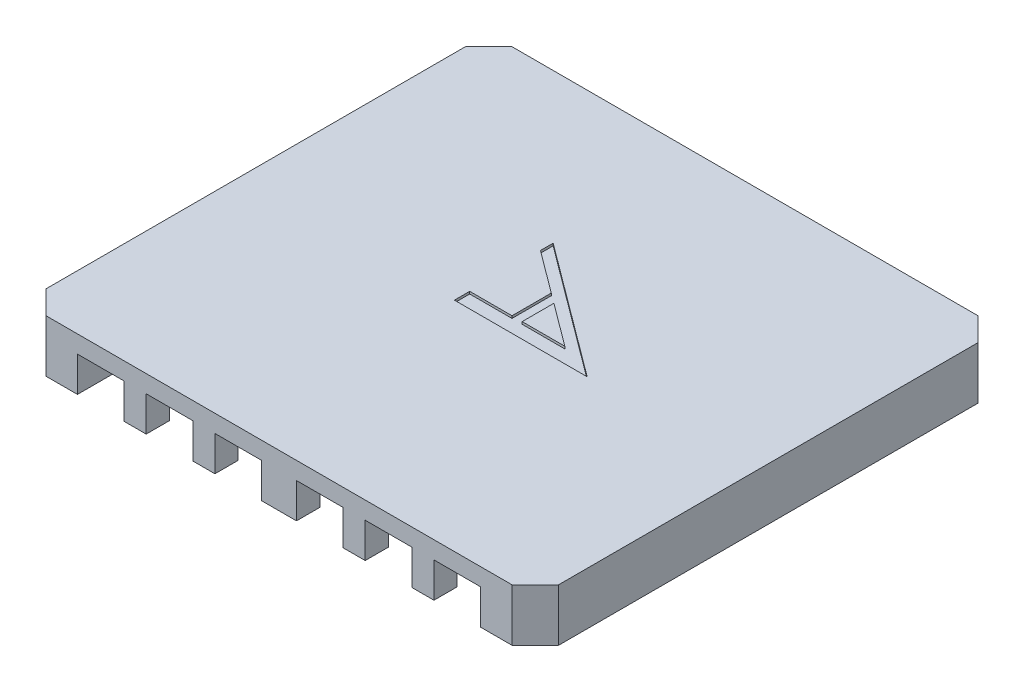
from build123d import *

# Parameters (mm, degrees)
SKETCH_1_W          = 44
SKETCH_1_H          = 40
EXTRUDE_1_DEPTH     = 4.5
CHAMFER_1_SIZE      = 2
SKETCH_2_W          = 34.6
SKETCH_2_H          = 36
SKETCH_2_W_2        = 3
SKETCH_2_H_2        = 20
CUT_EXTRUDE_1_DEPTH = 3
SKETCH_3_W          = 4
SKETCH_3_H          = 2
SKETCH_3_W_2        = 2.2
SKETCH_3_W_3        = 2.5
CUT_EXTRUDE_2_DEPTH = 3
SKETCH_4_R          = 1
CUT_EXTRUDE_3_DEPTH = 3.5
CUT_EXTRUDE1_DEPTH  = 0.2


with BuildPart() as part:
    # 草图1 → 凸台-拉伸1 (new body)
    with BuildSketch(Plane(origin=(0, 0, 0), x_dir=(1, 0, 0), z_dir=(0, 1, 0))):
        Rectangle(SKETCH_1_W, SKETCH_1_H)
    extrude(amount=EXTRUDE_1_DEPTH)

    # 倒角1
    chamfer_1_edges = [part.edges().sort_by_distance(p)[0] for p in [
        (-22, 2.25, -20),
        (22, 2.25, -20),
        (22, 2.25, 20),
        (-22, 2.25, 20),
    ]]
    chamfer(chamfer_1_edges, length=CHAMFER_1_SIZE)

    # 草图2 → 切除-拉伸1 (cut)
    with BuildSketch(Plane.XZ):
        Rectangle(SKETCH_2_W, SKETCH_2_H)
        Rectangle(SKETCH_2_W_2, SKETCH_2_H_2, mode=Mode.SUBTRACT)
    extrude(amount=-CUT_EXTRUDE_1_DEPTH, mode=Mode.SUBTRACT)

    # 草图3 → 切除-拉伸2 (cut)
    with BuildSketch(Plane.XZ):
        with Locations((-15.3, 19)):
            Rectangle(SKETCH_3_W, SKETCH_3_H)
        with Locations((-3.5, 19)):
            Rectangle(SKETCH_3_W, SKETCH_3_H)
        with Locations((-9.4, 19)):
            Rectangle(SKETCH_3_W, SKETCH_3_H)
        with Locations((3.5, 19)):
            Rectangle(SKETCH_3_W, SKETCH_3_H)
        with Locations((9.4, 19)):
            Rectangle(SKETCH_3_W, SKETCH_3_H)
        with Locations((15.3, 19)):
            Rectangle(SKETCH_3_W, SKETCH_3_H)
        with Locations((-2.6, -19)):
            Rectangle(SKETCH_3_W_2, SKETCH_3_H)
        with Locations((-9.4, -19)):
            Rectangle(SKETCH_3_W_3, SKETCH_3_H)
        with Locations((-16.2, -19)):
            Rectangle(SKETCH_3_W_2, SKETCH_3_H)
        with Locations((16.2, -19)):
            Rectangle(SKETCH_3_W_2, SKETCH_3_H)
        with Locations((9.4, -19)):
            Rectangle(SKETCH_3_W_3, SKETCH_3_H)
        with Locations((2.6, -19)):
            Rectangle(SKETCH_3_W_2, SKETCH_3_H)
    extrude(amount=-CUT_EXTRUDE_2_DEPTH, mode=Mode.SUBTRACT)

    # 草图4 → 切除-拉伸3 (cut)
    with BuildSketch(Plane.XZ):
        with Locations((19.3, 15)):
            Circle(SKETCH_4_R)
        with Locations((19.3, -12)):
            Circle(SKETCH_4_R)
        with Locations((-19.3, 15)):
            Circle(SKETCH_4_R)
        with Locations((-19.3, -12)):
            Circle(SKETCH_4_R)
    extrude(amount=-CUT_EXTRUDE_3_DEPTH, mode=Mode.SUBTRACT)

    # Sketch1 → Cut-Extrude1 (cut)
    with BuildSketch(Plane(origin=(0, 4.5, 0), x_dir=(1, 0, 0), z_dir=(0, 1, 0))):
        Polygon((-3.629184226, 0), (0, 0), (0, 3.372369248), (-3.629184226, 6.071279809), (-3.629184226, 7.160922507), (6, 0), (7.764502689, -1.312205346), (-3.629184226, -1.312205346), align=None)
        Polygon((0.871881915, 0), (4.53477394, 0), (0.871881915, 2.723977995), align=None, mode=Mode.SUBTRACT)
    extrude(amount=-CUT_EXTRUDE1_DEPTH, mode=Mode.SUBTRACT)


solid = part.part
